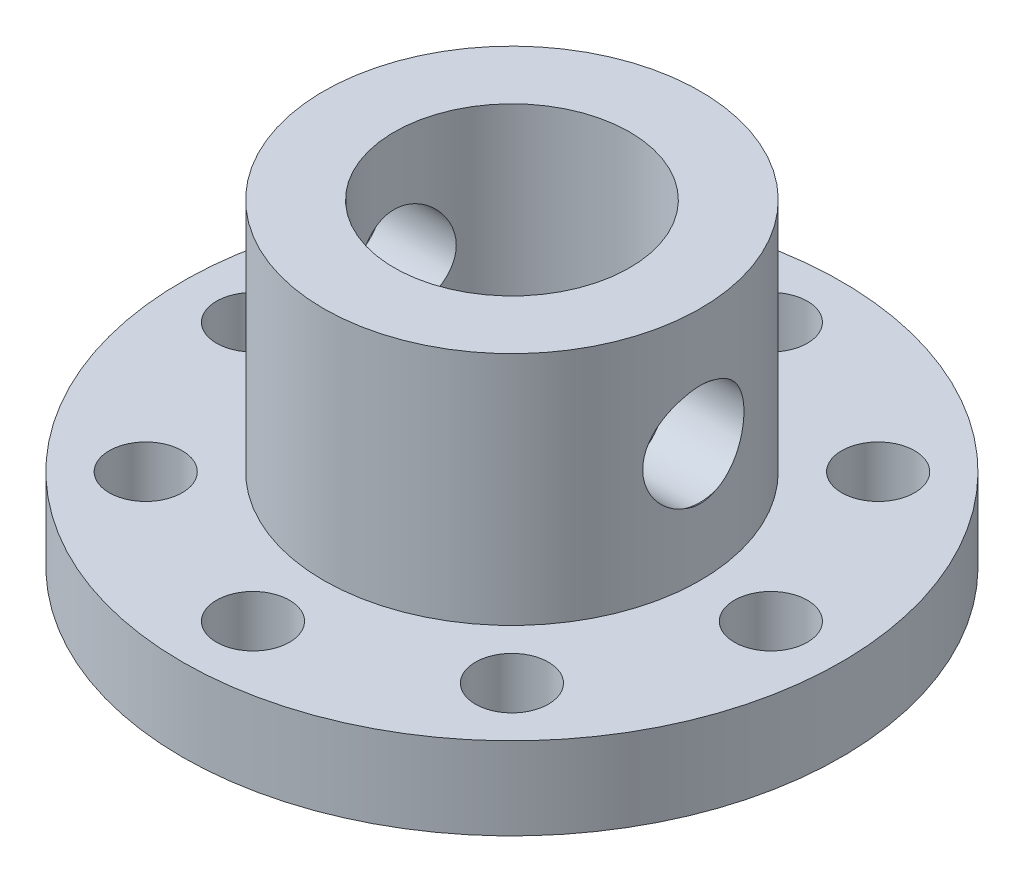
from build123d import *

# Parameters (mm, degrees)
SKETCH1_R                      = 14
BOSS_EXTRUDE1_DEPTH            = 1.75
M2_5_CLEARANCE_HOLE1_D         = 3.1
M2_5_CLEARANCE_HOLE1_DEPTH     = 6
M2_5_CLEARANCE_HOLE1_TIP       = 0.931333959
SKETCH9_R                      = 8
BOSS_EXTRUDE2_DEPTH            = 10
SKETCH7_R                      = 5
CUT_EXTRUDE1_DEPTH             = 24.963513933
M4_CLEARANCE_HOLE1_D           = 4.3
M4_CLEARANCE_HOLE1_DEPTH       = 25.4
M4_CLEARANCE_HOLE1_CSINK_D     = 4.35
M4_CLEARANCE_HOLE1_CSINK_ANGLE = 90
M4_CLEARANCE_HOLE1_TIP         = 1.291850331


with BuildPart() as part:
    # Sketch1 → Boss-Extrude1 (new, symmetric)
    with BuildSketch(Plane(origin=(0, 0, 0), x_dir=(1, 0, 0), z_dir=(0, 1, 0))):
        Circle(SKETCH1_R)
    extrude(amount=BOSS_EXTRUDE1_DEPTH, both=True)

    # M2.5 Clearance Hole1
    with Locations(Plane(origin=(0, 1.75, 0), x_dir=(1, 0, 0), z_dir=(0, 1, 0))):
        with Locations((-11, 0), (-7.778174593, 7.778174593), (0, 11), (7.778174593, 7.778174593), (11, 0), (7.778174593, -7.778174593), (0, -11), (-7.778174593, -7.778174593)):
            Hole(M2_5_CLEARANCE_HOLE1_D / 2, depth=M2_5_CLEARANCE_HOLE1_DEPTH)
            with Locations((0, 0, -(M2_5_CLEARANCE_HOLE1_DEPTH + M2_5_CLEARANCE_HOLE1_TIP / 2))):  # 118° drill point
                Cone(0, M2_5_CLEARANCE_HOLE1_D / 2, M2_5_CLEARANCE_HOLE1_TIP, mode=Mode.SUBTRACT)

    # Sketch9 → Boss-Extrude2 (add)
    with BuildSketch(Plane(origin=(0, 1.75, 0), x_dir=(1, 0, 0), z_dir=(0, 1, 0))):
        Circle(SKETCH9_R)
    extrude(amount=BOSS_EXTRUDE2_DEPTH)

    # Sketch7 → Cut-Extrude1 (cut, through all)
    with BuildSketch(Plane.XZ.offset(1.75)):
        Circle(SKETCH7_R)
    extrude(amount=-CUT_EXTRUDE1_DEPTH, mode=Mode.SUBTRACT)

    # M4 Clearance Hole1
    with Locations(Plane(origin=(8, 0, 0), x_dir=(0, 0, -1), z_dir=(1, 0, 0))):
        with Locations((0, 6.75)):
            CounterSinkHole(M4_CLEARANCE_HOLE1_D / 2, M4_CLEARANCE_HOLE1_CSINK_D / 2, depth=M4_CLEARANCE_HOLE1_DEPTH, counter_sink_angle=M4_CLEARANCE_HOLE1_CSINK_ANGLE)
            with Locations((0, 0, -(M4_CLEARANCE_HOLE1_DEPTH + M4_CLEARANCE_HOLE1_TIP / 2))):  # 118° drill point
                Cone(0, M4_CLEARANCE_HOLE1_D / 2, M4_CLEARANCE_HOLE1_TIP, mode=Mode.SUBTRACT)


solid = part.part
